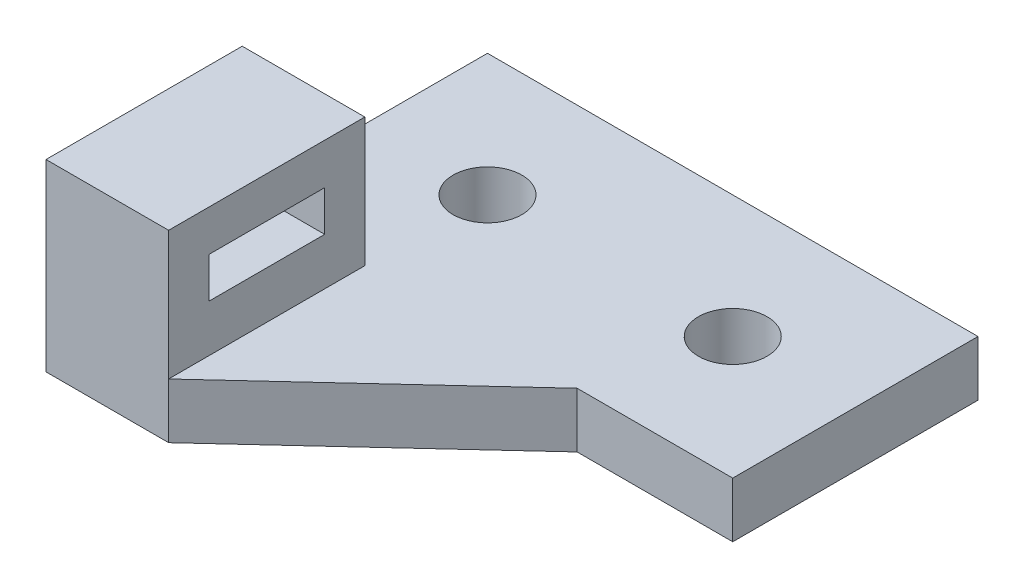
from build123d import *

# Parameters (mm, degrees)
SKETCH1_R           = 2.8
BOSS_EXTRUDE1_DEPTH = 4.5
SKETCH1_3_W         = 10
SKETCH1_3_H         = 16
BOSS_EXTRUDE2_DEPTH = 15
SKETCH2_W           = 9.45
SKETCH2_H           = 3.3
CUT_EXTRUDE1_DEPTH  = 43.438190348


with BuildPart() as part:
    # Sketch1 → Boss-Extrude1 (new body)
    with BuildSketch(Plane(origin=(0, 0, 0), x_dir=(1, 0, 0), z_dir=(0, 1, 0))):
        Polygon((30, 10), (-10, 10), (-10, -10), (0, -10), (0, -26), (17.312307583, -10), (30, -10), align=None)
        Circle(SKETCH1_R, mode=Mode.SUBTRACT)
        with Locations((20, 0)):
            Circle(SKETCH1_R, mode=Mode.SUBTRACT)
    extrude(amount=BOSS_EXTRUDE1_DEPTH)

    # Sketch1<3> → Boss-Extrude2 (add)
    with BuildSketch(Plane(origin=(0, 0, 0), x_dir=(1, 0, 0), z_dir=(0, 1, 0))):
        with Locations((-5, -18)):
            Rectangle(SKETCH1_3_W, SKETCH1_3_H)
    extrude(amount=BOSS_EXTRUDE2_DEPTH)

    # Sketch2 → Cut-Extrude1 (cut, through all)
    with BuildSketch(Plane(origin=(0, 0, 0), x_dir=(0, 0, -1), z_dir=(1, 0, 0))):
        with Locations((-18, 10)):
            Rectangle(SKETCH2_W, SKETCH2_H)
    extrude(amount=-CUT_EXTRUDE1_DEPTH, mode=Mode.SUBTRACT)


solid = part.part
